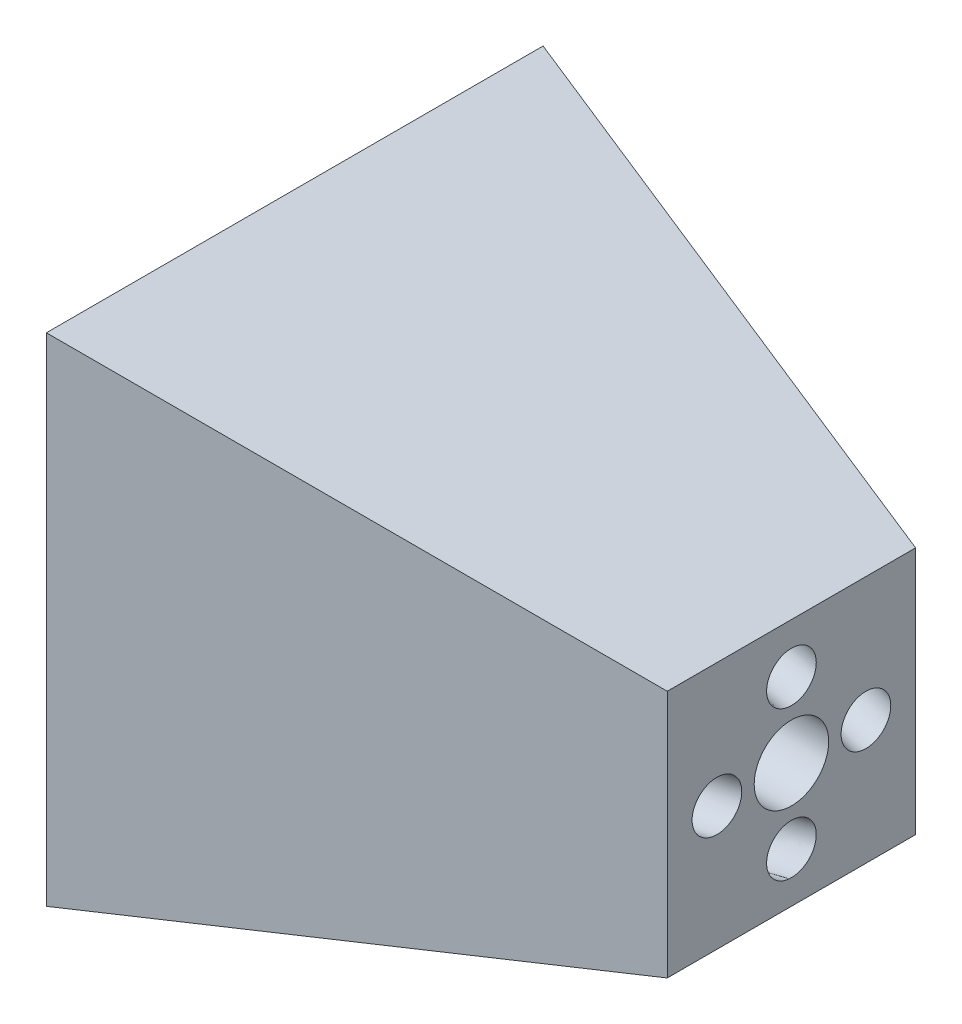
from build123d import *

# Parameters (mm, degrees)
CIRPATTERN1_COUNT  = 4
SKETCH1_6_R        = 190.5
CUT_EXTRUDE1_DEPTH = 3111.851973498


with BuildPart() as part:
    # Sketch1 → Loft2 section 0
    with BuildSketch(Plane(origin=(0, 0, 0), x_dir=(0, 0, -1), z_dir=(1, 0, 0))):
        with BuildLine():
            Line((1270, 1270), (-1270, 1270))
            Line((-1270, 1270), (-1270, -1270))
            Line((-1270, -1270), (1270, -1270))
            Line((1270, -1270), (1270, 1270))
        make_face()
    # Sketch2 → Loft2 section 1
    with BuildSketch(Plane(origin=(2540, 0, 0), x_dir=(0, 0, -1), z_dir=(1, 0, 0))):
        with BuildLine():
            Line((635, 635), (-635, 635))
            Line((-635, 635), (-635, -635))
            Line((-635, -635), (635, -635))
            Line((635, -635), (635, 635))
        make_face()
    loft()

    # Cut-Loft1: read off the stored shape, not the designer's step
    # Cut-Loft1: loft between two sections, ruled curve by curve
    cut_loft1_from = [
        Edge.make_bspline([(2540, 11.236587684, 507.501933176), (2540, 16.507501566, 507.033742022), (2540, 22.082084427, 506.209068305), (2540, 30.85311909, 504.231762756), (2540, 33.84434043, 503.44884836), (2540, 39.9443121, 501.596897865), (2540, 43.053115831, 500.52781571), (2540, 49.3622151, 498.063406885), (2540, 52.562560177, 496.668011701), (2540, 59.01855305, 493.510986393), (2540, 62.274238152, 491.749262482), (2540, 68.793231703, 487.82214728), (2540, 72.056554062, 485.656636996), (2540, 78.530837978, 480.890270482), (2540, 81.741776921, 478.289274932), (2540, 88.039083183, 472.629912929), (2540, 91.125378356, 469.571398367), (2540, 97.090331864, 462.988991016), (2540, 99.96885914, 459.464960478), (2540, 105.427374654, 451.961901709), (2540, 108.007171718, 447.982771817), (2540, 112.774327164, 439.601979452), (2540, 114.961445622, 435.200279765), (2540, 118.85287192, 426.031090842), (2540, 120.556917197, 421.263652909), (2540, 123.403006668, 411.443882389), (2540, 124.54480437, 406.391700936), (2540, 126.206186185, 396.10448081), (2540, 126.72558373, 390.8696847), (2540, 127.107597326, 380.334455396), (2540, 126.970124329, 375.034326199), (2540, 126.033742022, 364.492498434), (2540, 125.234861067, 359.251119079), (2540, 123.001887213, 348.94816714), (2540, 121.567935553, 343.886878098), (2540, 118.119337898, 334.053554059), (2540, 116.104918305, 329.281724941), (2540, 111.572553973, 320.117348699), (2540, 109.054878507, 315.724906896), (2540, 103.60821516, 307.385177732), (2540, 100.679494773, 303.437894593), (2540, 94.509775933, 296.028574709), (2540, 91.269007087, 292.566459044), (2540, 84.573461841, 286.142989859), (2540, 81.118855703, 283.181502574), (2540, 74.087075617, 277.753535577), (2540, 70.510006397, 275.286897174), (2540, 63.31377312, 270.826104524), (2540, 59.694653974, 268.831791771), (2540, 52.481613402, 265.28120764), (2540, 48.887689679, 263.724795137), (2540, 41.778566033, 261.008203206), (2540, 38.263331446, 259.847909098), (2540, 31.351958284, 257.878245728), (2540, 27.955766457, 257.068790723), (2540, 21.311067769, 255.755008477), (2540, 18.062500069, 255.250622526), (2540, 11.731606802, 254.502848864), (2540, 8.649220552, 254.259425228), (2540, -0.333011624, 253.859061111), (2540, -5.965673801, 254.029875671), (2540, -16.507501566, 254.966257978), (2540, -22.082084427, 255.790931695), (2540, -30.85311909, 257.768237244), (2540, -33.84434043, 258.55115164), (2540, -39.9443121, 260.403102135), (2540, -43.053115831, 261.47218429), (2540, -49.3622151, 263.936593115), (2540, -52.562560177, 265.331988299), (2540, -59.01855305, 268.489013607), (2540, -62.274238152, 270.250737518), (2540, -68.793231703, 274.17785272), (2540, -72.056554062, 276.343363004), (2540, -78.530837978, 281.109729518), (2540, -81.741776921, 283.710725068), (2540, -88.039083183, 289.370087071), (2540, -91.125378356, 292.428601633), (2540, -97.090331864, 299.011008984), (2540, -99.96885914, 302.535039522), (2540, -105.427374654, 310.038098291), (2540, -108.007171718, 314.017228183), (2540, -112.774327164, 322.398020548), (2540, -114.961445622, 326.799720235), (2540, -118.85287192, 335.968909158), (2540, -120.556917197, 340.736347091), (2540, -123.403006668, 350.556117611), (2540, -124.54480437, 355.608299064), (2540, -126.206186185, 365.89551919), (2540, -126.72558373, 371.1303153), (2540, -127.107597326, 381.665544604), (2540, -126.970124329, 386.965673801), (2540, -126.033742022, 397.507501566), (2540, -125.234861067, 402.748880921), (2540, -123.001887213, 413.05183286), (2540, -121.567935553, 418.113121902), (2540, -118.119337898, 427.946445941), (2540, -116.104918305, 432.718275059), (2540, -111.572553973, 441.882651301), (2540, -109.054878507, 446.275093104), (2540, -103.60821516, 454.614822268), (2540, -100.679494773, 458.562105407), (2540, -94.509775933, 465.971425291), (2540, -91.269007087, 469.433540956), (2540, -84.573461841, 475.857010141), (2540, -81.118855703, 478.818497426), (2540, -74.087075617, 484.246464423), (2540, -70.510006397, 486.713102826), (2540, -63.31377312, 491.173895476), (2540, -59.694653974, 493.168208229), (2540, -52.481613402, 496.71879236), (2540, -48.887689678, 498.275204863), (2540, -41.778566033, 500.991796794), (2540, -38.263331446, 502.152090902), (2540, -31.351958284, 504.121754272), (2540, -27.955766457, 504.931209277), (2540, -21.311067769, 506.244991523), (2540, -18.062500069, 506.749377474), (2540, -11.731606802, 507.497151136), (2540, -8.649220552, 507.740574772), (2540, 0.333011624, 508.140938889), (2540, 5.965673801, 507.970124329), (2540, 11.236587684, 507.501933176)], [0, 0, 0, 0, 0.03125, 0.03125, 0.046875, 0.046875, 0.0625, 0.0625, 0.078125, 0.078125, 0.09375, 0.09375, 0.109375, 0.109375, 0.125, 0.125, 0.140625, 0.140625, 0.15625, 0.15625, 0.171875, 0.171875, 0.1875, 0.1875, 0.203125, 0.203125, 0.21875, 0.21875, 0.234375, 0.234375, 0.25, 0.25, 0.265625, 0.265625, 0.28125, 0.28125, 0.296875, 0.296875, 0.3125, 0.3125, 0.328125, 0.328125, 0.34375, 0.34375, 0.359375, 0.359375, 0.375, 0.375, 0.390625, 0.390625, 0.40625, 0.40625, 0.421875, 0.421875, 0.4375, 0.4375, 0.453125, 0.453125, 0.46875, 0.46875, 0.5, 0.5, 0.53125, 0.53125, 0.546875, 0.546875, 0.5625, 0.5625, 0.578125, 0.578125, 0.59375, 0.59375, 0.609375, 0.609375, 0.625, 0.625, 0.640625, 0.640625, 0.65625, 0.65625, 0.671875, 0.671875, 0.6875, 0.6875, 0.703125, 0.703125, 0.71875, 0.71875, 0.734375, 0.734375, 0.75, 0.75, 0.765625, 0.765625, 0.78125, 0.78125, 0.796875, 0.796875, 0.8125, 0.8125, 0.828125, 0.828125, 0.84375, 0.84375, 0.859375, 0.859375, 0.875, 0.875, 0.890625, 0.890625, 0.90625, 0.90625, 0.921875, 0.921875, 0.9375, 0.9375, 0.953125, 0.953125, 0.96875, 0.96875, 1, 1, 1, 1], 3),
    ]
    cut_loft1_to = [
        Edge.make_bspline([(0, -35.431870467, 1137.957298081), (0, -30.35031638, 1139.433626017), (0, -24.856436793, 1140.687957672), (0, -15.965719937, 1142.028084555), (0, -12.894281311, 1142.383928382), (0, -6.538063071, 1142.871642123), (0, -3.253216983, 1143.003488497), (0, 3.520112611, 1142.99637128), (0, 7.008667141, 1142.857361821), (0, 14.170202019, 1142.258136522), (0, 17.843251163, 1141.797846824), (0, 25.342928338, 1140.503878899), (0, 29.169612509, 1139.670094835), (0, 36.932158824, 1137.577852815), (0, 40.86805045, 1136.319256827), (0, 48.7897145, 1133.330664662), (0, 52.775473437, 1131.600504293), (0, 60.722373895, 1127.63118067), (0, 64.683443271, 1125.391841502), (0, 72.492491306, 1120.380848458), (0, 76.340328711, 1117.609030481), (0, 83.823632727, 1111.529259703), (0, 87.458889271, 1108.221185166), (0, 94.412229256, 1101.08898444), (0, 97.730049411, 1097.264810783), (0, 103.945369918, 1089.147058055), (0, 106.842585736, 1084.853530376), (0, 112.123563545, 1075.870303739), (0, 114.507063669, 1071.180763112), (0, 118.685863613, 1061.502198037), (0, 120.480970145, 1056.513424554), (0, 123.433626017, 1046.35031638), (0, 124.591085949, 1041.176289435), (0, 126.248842966, 1030.765293682), (0, 126.749168775, 1025.528640341), (0, 127.103745274, 1015.114161816), (0, 126.958132229, 1009.936610632), (0, 126.060072985, 999.752230044), (0, 125.30783949, 994.745596494), (0, 123.258564622, 984.997894372), (0, 121.961770982, 980.256926798), (0, 118.901112516, 971.113851742), (0, 117.137490285, 966.711754035), (0, 113.2291173, 958.296535493), (0, 111.08457374, 954.283351791), (0, 106.501653718, 946.673778809), (0, 104.063432428, 943.077279656), (0, 98.976318016, 936.309287975), (0, 96.327524259, 933.13766404), (0, 90.894468968, 927.211745363), (0, 88.110256503, 924.457318279), (0, 82.471412318, 919.346257041), (0, 79.616789907, 916.989503445), (0, 73.891186991, 912.64621851), (0, 71.020187976, 910.659587949), (0, 65.305090246, 907.024247197), (0, 62.460956143, 905.37546022), (0, 56.832893491, 902.381418504), (0, 54.048921431, 901.03610827), (0, 45.824165019, 897.403730503), (0, 40.513424554, 895.519029855), (0, 30.35031638, 892.566373983), (0, 24.856436793, 891.312042328), (0, 15.965719937, 889.971915445), (0, 12.894281311, 889.616071618), (0, 6.538063071, 889.128357877), (0, 3.253216983, 888.996511503), (0, -3.520112611, 889.00362872), (0, -7.008667141, 889.142638179), (0, -14.170202019, 889.741863478), (0, -17.843251163, 890.202153176), (0, -25.342928338, 891.496121101), (0, -29.169612509, 892.329905165), (0, -36.932158824, 894.422147185), (0, -40.86805045, 895.680743173), (0, -48.7897145, 898.669335338), (0, -52.775473437, 900.399495707), (0, -60.722373895, 904.36881933), (0, -64.683443271, 906.608158498), (0, -72.492491306, 911.619151542), (0, -76.340328711, 914.390969519), (0, -83.823632727, 920.470740297), (0, -87.458889271, 923.778814834), (0, -94.412229256, 930.91101556), (0, -97.730049411, 934.735189217), (0, -103.945369918, 942.852941945), (0, -106.842585736, 947.146469624), (0, -112.123563545, 956.129696261), (0, -114.507063669, 960.819236888), (0, -118.685863613, 970.497801963), (0, -120.480970145, 975.486575446), (0, -123.433626017, 985.64968362), (0, -124.591085949, 990.823710565), (0, -126.248842966, 1001.234706318), (0, -126.749168775, 1006.471359659), (0, -127.103745274, 1016.885838184), (0, -126.958132229, 1022.063389368), (0, -126.060072985, 1032.247769956), (0, -125.30783949, 1037.254403506), (0, -123.258564622, 1047.002105628), (0, -121.961770982, 1051.743073202), (0, -118.901112516, 1060.886148258), (0, -117.137490285, 1065.288245965), (0, -113.2291173, 1073.703464507), (0, -111.08457374, 1077.716648209), (0, -106.501653718, 1085.326221191), (0, -104.063432428, 1088.922720344), (0, -98.976318016, 1095.690712025), (0, -96.327524259, 1098.86233596), (0, -90.894468968, 1104.788254637), (0, -88.110256503, 1107.542681721), (0, -82.471412318, 1112.653742959), (0, -79.616789907, 1115.010496555), (0, -73.891186991, 1119.35378149), (0, -71.020187976, 1121.340412051), (0, -65.305090246, 1124.975752803), (0, -62.460956143, 1126.62453978), (0, -56.832893491, 1129.618581496), (0, -54.048921431, 1130.96389173), (0, -45.824165019, 1134.596269497), (0, -40.513424554, 1136.480970145), (0, -35.431870467, 1137.957298081)], [0, 0, 0, 0, 0.03125, 0.03125, 0.046875, 0.046875, 0.0625, 0.0625, 0.078125, 0.078125, 0.09375, 0.09375, 0.109375, 0.109375, 0.125, 0.125, 0.140625, 0.140625, 0.15625, 0.15625, 0.171875, 0.171875, 0.1875, 0.1875, 0.203125, 0.203125, 0.21875, 0.21875, 0.234375, 0.234375, 0.25, 0.25, 0.265625, 0.265625, 0.28125, 0.28125, 0.296875, 0.296875, 0.3125, 0.3125, 0.328125, 0.328125, 0.34375, 0.34375, 0.359375, 0.359375, 0.375, 0.375, 0.390625, 0.390625, 0.40625, 0.40625, 0.421875, 0.421875, 0.4375, 0.4375, 0.453125, 0.453125, 0.46875, 0.46875, 0.5, 0.5, 0.53125, 0.53125, 0.546875, 0.546875, 0.5625, 0.5625, 0.578125, 0.578125, 0.59375, 0.59375, 0.609375, 0.609375, 0.625, 0.625, 0.640625, 0.640625, 0.65625, 0.65625, 0.671875, 0.671875, 0.6875, 0.6875, 0.703125, 0.703125, 0.71875, 0.71875, 0.734375, 0.734375, 0.75, 0.75, 0.765625, 0.765625, 0.78125, 0.78125, 0.796875, 0.796875, 0.8125, 0.8125, 0.828125, 0.828125, 0.84375, 0.84375, 0.859375, 0.859375, 0.875, 0.875, 0.890625, 0.890625, 0.90625, 0.90625, 0.921875, 0.921875, 0.9375, 0.9375, 0.953125, 0.953125, 0.96875, 0.96875, 1, 1, 1, 1], 3),
    ]
    cut_loft1 = Solid(Shell([*[Face.make_surface_from_curves(cut_loft1_from[k], cut_loft1_to[k]) for k in range(1)], Face(Wire(cut_loft1_from)), Face(Wire(cut_loft1_to))]))
    add(cut_loft1, mode=Mode.SUBTRACT)

    # CirPattern1: Cut-Loft1 ×4 about axis
    cirpattern1_axis = Axis((0, 0, 0), (1, 0, 0))
    for i in range(1, CIRPATTERN1_COUNT):
        add(cut_loft1.rotate(cirpattern1_axis, i * 360 / CIRPATTERN1_COUNT), mode=Mode.SUBTRACT)

    # Sketch1<6> → Cut-Extrude1 (cut, through all)
    with BuildSketch(Plane(origin=(0, 0, 0), x_dir=(0, 0, -1), z_dir=(1, 0, 0))):
        with Locations(Location((0, 0, 0), (0, 0, 180))):
            Circle(SKETCH1_6_R)
    extrude(amount=CUT_EXTRUDE1_DEPTH, mode=Mode.SUBTRACT)


solid = part.part
